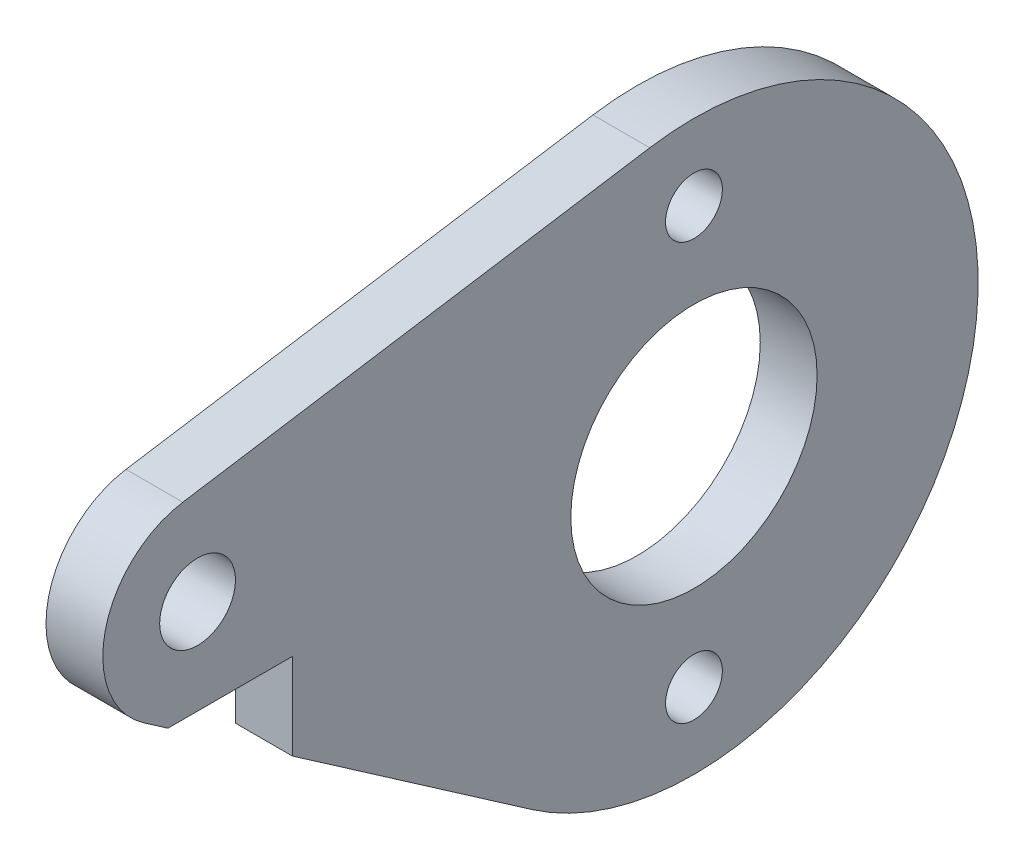
from build123d import *

# Parameters (mm, degrees)
ESQUISSE1_R             = 6.5
ESQUISSE1_R_2           = 1.5
ESQUISSE1_R_3           = 2
BOSS_EXTRU_1_DEPTH      = 3
ENL_V_MAT_EXTRU_1_DEPTH = 35.748237365


with BuildPart() as part:
    # Esquisse1 → Boss.-Extru.1 (new body)
    with BuildSketch(Plane.ZY):
        with BuildLine():
            Line((29.049319561, 1.891304582), (8.547958684, -12.326086254))
            ThreePointArc((8.547958684, -12.326086254), (-14.621490903, -3.348433031), (2.331837562, 14.817642646))
            Line((2.331837562, 14.817642646), (26.977279187, 10.939214215))
            ThreePointArc((26.977279187, 10.939214215), (31.073830301, 7.116144344), (29.049319561, 1.891304582))
        make_face()
        Circle(ESQUISSE1_R, mode=Mode.SUBTRACT)
        with Locations((0, 11)):
            Circle(ESQUISSE1_R_2, mode=Mode.SUBTRACT)
        with Locations((0, -11)):
            Circle(ESQUISSE1_R_2, mode=Mode.SUBTRACT)
        with Locations((26.2, 6)):
            Circle(ESQUISSE1_R_3, mode=Mode.SUBTRACT)
    extrude(amount=-BOSS_EXTRU_1_DEPTH)

    # Esquisse2 → Enlèv. mat.-Extru.1 (cut, through all)
    with BuildSketch(Plane(origin=(3, 0, 0), x_dir=(0, 0, -1), z_dir=(1, 0, 0))):
        Polygon((-27.764065671, 1), (-21.2, 1), (-21.2, -3.55208255), align=None)
    extrude(amount=-ENL_V_MAT_EXTRU_1_DEPTH, mode=Mode.SUBTRACT)


solid = part.part
